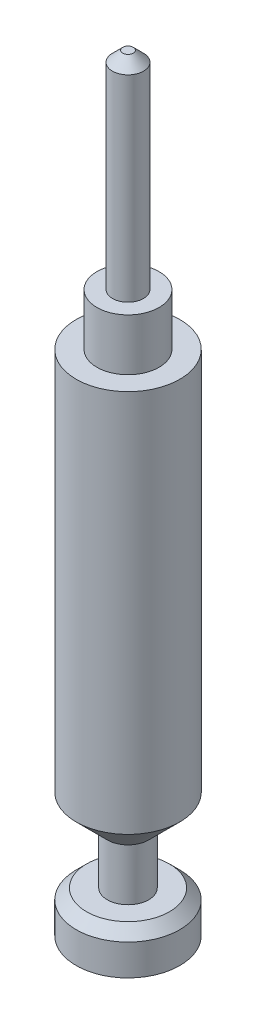
from build123d import *

# Parameters (mm, degrees)
SKETCH1_R           = 5
BOSS_EXTRUDE1_DEPTH = 40
SKETCH2_R           = 3
BOSS_EXTRUDE2_DEPTH = 5
SKETCH3_R           = 1.5
BOSS_EXTRUDE3_DEPTH = 20
CHAMFER1_SIZE       = 1
SKETCH4_R           = 2
BOSS_EXTRUDE4_DEPTH = 5
BOSS_EXTRUDE5_START = 4
SKETCH5_R           = 5
BOSS_EXTRUDE5_DEPTH = 4
CHAMFER2_SIZE       = 3
CHAMFER3_SIZE       = 1


with BuildPart() as part:
    # Sketch1 → Boss-Extrude1 (new body)
    with BuildSketch(Plane(origin=(0, 0, 0), x_dir=(1, 0, 0), z_dir=(0, 1, 0))):
        with Locations(Location((0, 0, 0), (0, 0, 270))):
            Circle(SKETCH1_R)
    extrude(amount=BOSS_EXTRUDE1_DEPTH)

    # Sketch2 → Boss-Extrude2 (add)
    with BuildSketch(Plane(origin=(0, 40, 0), x_dir=(1, 0, 0), z_dir=(0, 1, 0))):
        with Locations(Location((0, 0, 0), (0, 0, 270))):
            Circle(SKETCH2_R)
    extrude(amount=BOSS_EXTRUDE2_DEPTH)

    # Sketch3 → Boss-Extrude3 (add)
    with BuildSketch(Plane(origin=(0, 45, 0), x_dir=(1, 0, 0), z_dir=(0, 1, 0))):
        with Locations(Location((0, 0, 0), (0, 0, 270))):
            Circle(SKETCH3_R)
    extrude(amount=BOSS_EXTRUDE3_DEPTH)

    # Chamfer1
    chamfer1_edges = [part.edges().sort_by_distance(p)[0] for p in [
        (0, 65, -1.5),
    ]]
    chamfer(chamfer1_edges, length=CHAMFER1_SIZE)

    # Sketch4 → Boss-Extrude4 (add)
    with BuildSketch(Plane.XZ):
        with Locations(Location((0, 0, 0), (0, 0, 270))):
            Circle(SKETCH4_R)
    extrude(amount=BOSS_EXTRUDE4_DEPTH)

    # Sketch5 → Boss-Extrude5 (add)
    with BuildSketch(Plane.XZ.offset(5).offset(BOSS_EXTRUDE5_START)):
        with Locations(Location((0, 0, 0), (0, 0, 90))):
            Circle(SKETCH5_R)
    extrude(amount=-BOSS_EXTRUDE5_DEPTH)

    # Chamfer2
    chamfer2_edges = [part.edges().sort_by_distance(p)[0] for p in [
        (0, 0, -5),
    ]]
    chamfer(chamfer2_edges, length=CHAMFER2_SIZE - 0.0001)  # a hair under: the kernel refuses the full size

    # Chamfer3
    chamfer3_edges = [part.edges().sort_by_distance(p)[0] for p in [
        (0, -5, -5),
    ]]
    chamfer(chamfer3_edges, length=CHAMFER3_SIZE)


solid = part.part
